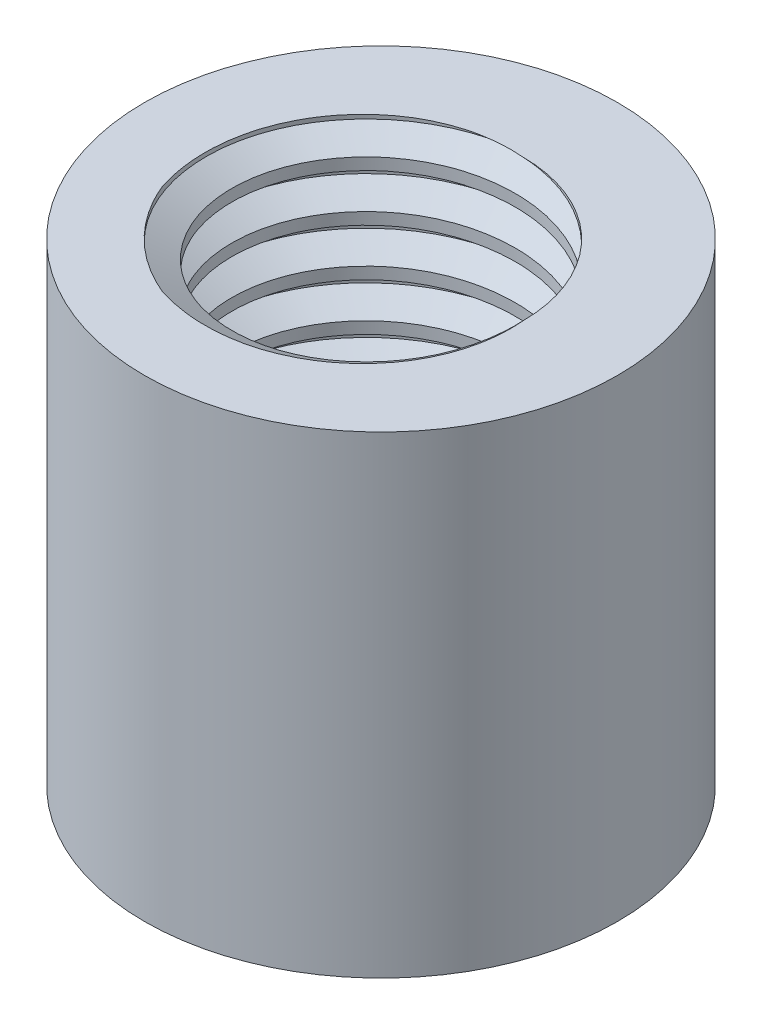
from build123d import *

# Parameters (mm, degrees)
SKETCH2_R           = 5
SKETCH2_R_2         = 3
BOSS_EXTRUDE1_DEPTH = 10
SKETCH3_R           = 3
BOSS_EXTRUDE2_DEPTH = 3
THREAD1_PITCH       = 1


with BuildPart() as part:
    # Sketch2 → Boss-Extrude1 (new body)
    with BuildSketch(Plane(origin=(0, 0, 0), x_dir=(1, 0, 0), z_dir=(0, 1, 0))):
        with Locations(Location((0, 0, 0), (0, 0, 270))):
            Circle(SKETCH2_R)
        with Locations(Location((0, 0, 0), (0, 0, 270))):
            Circle(SKETCH2_R_2, mode=Mode.SUBTRACT)
    extrude(amount=BOSS_EXTRUDE1_DEPTH)

    # Sketch3 → Boss-Extrude2 (add)
    with BuildSketch(Plane(origin=(0, 0, 0), x_dir=(1, 0, 0), z_dir=(0, 1, 0))):
        with Locations(Location((0, 0, 0), (0, 0, 270))):
            Circle(SKETCH3_R)
    extrude(amount=BOSS_EXTRUDE2_DEPTH)

    # Thread1: the profile of Thread Profile2 profile screwed along a right-hand helix of 10 turns, 8 arcs to a turn; built about Z, then put on its axis
    thread1_z = Axis((0, 0, 0), (0, 0, 1))
    thread1_corners = [(2.9997, 0, -0.000173205), (3.541265875, 0, 0.312499999), (3.541265875, 0, 0.437499999), (2.9997, 0, 0.750173202)]
    with BuildLine(mode=Mode.PRIVATE) as thread1_profile:
        Line(thread1_corners[0], thread1_corners[1])
        Line(thread1_corners[1], thread1_corners[2])
        Line(thread1_corners[2], thread1_corners[3])
        Line(thread1_corners[3], thread1_corners[0])
    thread1_cap = Face(thread1_profile.wire())
    thread1_turn_angles = [0, 22.5, 45, 67.5, 90, 112.5, 135, 157.5, 180, 202.5, 225, 247.5, 270, 292.5, 315, 337.5, 360]
    thread1_turn_weights = [1, 0.9238795325112867, 1, 0.9238795325112867, 1, 0.9238795325112867, 1, 0.9238795325112867, 1, 0.9238795325112867, 1, 0.9238795325112867, 1, 0.9238795325112867, 1, 0.9238795325112867, 1]
    thread1_turn_rails = [Edge.make_bspline([Vector(p[0], p[1], 0).rotate(thread1_z, thread1_turn_angles[k]) / thread1_turn_weights[k] + Vector(0, 0, p[2] + THREAD1_PITCH * thread1_turn_angles[k] / 360) for k in range(17)], [0, 0, 0, 1, 1, 2, 2, 3, 3, 4, 4, 5, 5, 6, 6, 7, 7, 8, 8, 8], 2, thread1_turn_weights) for p in thread1_corners]
    thread1_turn_sides = [Face.make_surface_from_curves(thread1_turn_rails[p[0]], thread1_turn_rails[p[1]]) for p in [(0, 1), (1, 2), (2, 3), (3, 0)]]
    thread1 = Plane(origin=(0, 2, 0), x_dir=(1, 0, 0), z_dir=(0, 1, 0)) * Solid(Shell([*[p.moved(Location((0, 0, THREAD1_PITCH * i))) for i in range(10) for p in thread1_turn_sides], thread1_cap, thread1_cap.rotate(thread1_z, 3600).moved(Location((0, 0, THREAD1_PITCH * 3600 / 360)))]))
    add(thread1, mode=Mode.SUBTRACT)


solid = part.part
